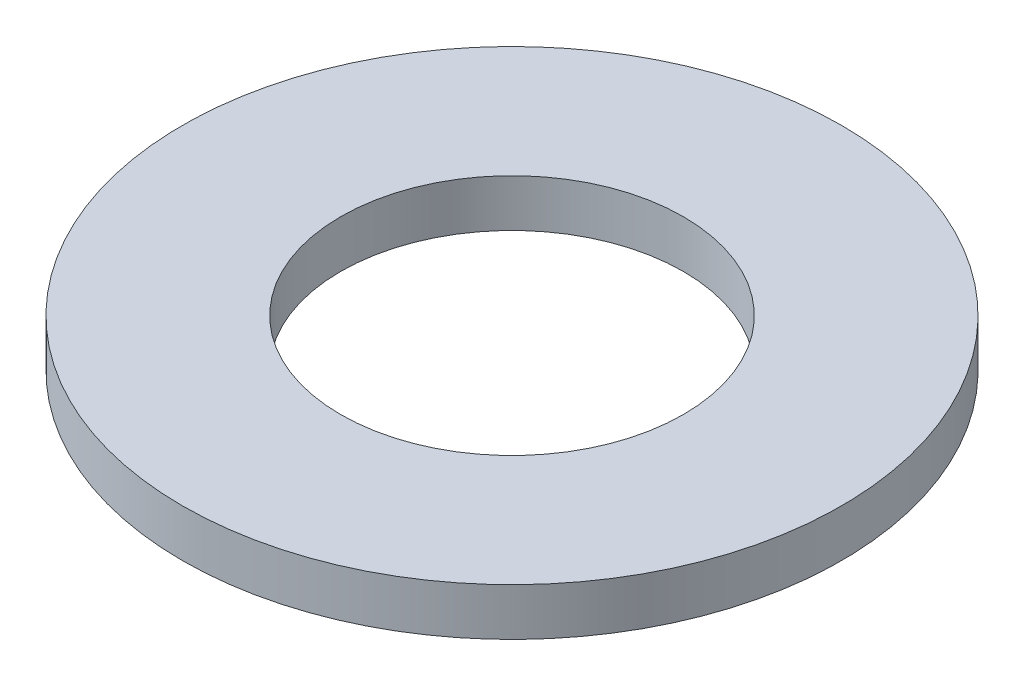
from build123d import *

# Parameters (mm, degrees)
SKETCH1_R           = 62.5
BOSS_EXTRUDE1_DEPTH = 9
SKETCH2_R           = 32.5
CUT_EXTRUDE1_DEPTH  = 89.845371292


with BuildPart() as part:
    # Sketch1 → Boss-Extrude1 (new body)
    with BuildSketch(Plane(origin=(0, 0, 0), x_dir=(1, 0, 0), z_dir=(0, 1, 0))):
        Circle(SKETCH1_R)
    extrude(amount=BOSS_EXTRUDE1_DEPTH)

    # Sketch2 → Cut-Extrude1 (cut, through all)
    with BuildSketch(Plane(origin=(0, 0, 0), x_dir=(1, 0, 0), z_dir=(0, 1, 0))):
        Circle(SKETCH2_R)
    extrude(amount=CUT_EXTRUDE1_DEPTH, mode=Mode.SUBTRACT)


solid = part.part
